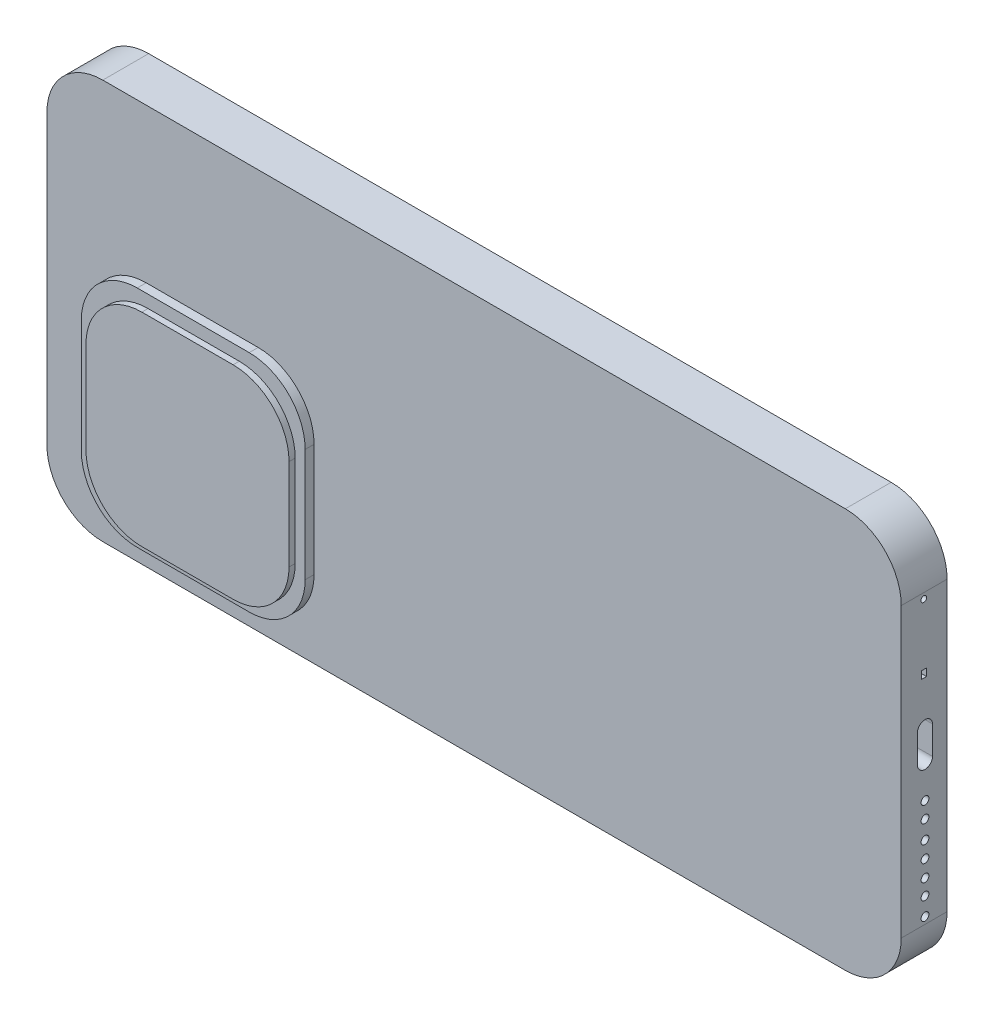
from build123d import *

# Parameters (mm, degrees)
EXTRUDE_1_DEPTH     = 8.2
EXTRUDE_2_DEPTH     = 9.8
EXTRUDE_4_DEPTH     = 10.9
CUT_EXTRUDE_2_DEPTH = 5
SKETCH_10_W         = 0.370057209
SKETCH_10_H         = 5.254812371
EXTRUDE_7_DEPTH     = 3
SKETCH_11_R         = 0.702134187
SKETCH_11_R_2       = 0.7
CUT_EXTRUDE_7_DEPTH = 3
EXTRUDE_9_DEPTH     = 1
EXTRUDE_10_DEPTH    = 1
SKETCH_18_R         = 0.525325968
CUT_EXTRUDE_8_DEPTH = 2
SKETCH_19_W         = 0.887666201
SKETCH_19_H         = 1.337170861
CUT_EXTRUDE_9_DEPTH = 2


with BuildPart() as part:
    # 草图1 → 凸台-拉伸1 (new body)
    with BuildSketch(Plane.XY):
        with BuildLine():
            Line((-10, 0), (-142.8, 0))
            ThreePointArc((-142.8, 0), (-149.871067812, 2.928932188), (-152.8, 10))
            Line((-152.8, 10), (-152.8, 61.5))
            ThreePointArc((-152.8, 61.5), (-149.871067812, 68.571067812), (-142.8, 71.5))
            Line((-142.8, 71.5), (-10, 71.5))
            ThreePointArc((-10, 71.5), (-2.928932188, 68.571067812), (0, 61.5))
            Line((0, 61.5), (0, 10))
            ThreePointArc((0, 10), (-2.928932188, 2.928932188), (-10, 0))
        make_face()
    extrude(amount=EXTRUDE_1_DEPTH)

    # 草图3 → 凸台-拉伸2 (add)
    with BuildSketch(Plane.XY):
        with BuildLine():
            Line((-135.046043945, 43.978629458), (-115.01487361, 43.978629458))
            ThreePointArc((-115.01487361, 43.978629458), (-107.943805798, 41.04969727), (-105.01487361, 33.978629458))
            Line((-105.01487361, 33.978629458), (-105.01487361, 13.799195529))
            ThreePointArc((-105.01487361, 13.799195529), (-107.943805798, 6.728127717), (-115.01487361, 3.799195529))
            Line((-115.01487361, 3.799195529), (-135.046043945, 3.799195529))
            ThreePointArc((-135.046043945, 3.799195529), (-142.117111757, 6.728127717), (-145.046043945, 13.799195529))
            Line((-145.046043945, 13.799195529), (-145.046043945, 33.978629458))
            ThreePointArc((-145.046043945, 33.978629458), (-142.117111757, 41.04969727), (-135.046043945, 43.978629458))
        make_face()
    extrude(amount=EXTRUDE_2_DEPTH)

    # 草图4 → 凸台-拉伸4 (add)
    with BuildSketch(Plane.XY):
        with BuildLine():
            Line((-133.118617225, 41.75467555), (-116.794036736, 41.75467555))
            ThreePointArc((-116.794036736, 41.75467555), (-109.722968924, 38.825743362), (-106.794036736, 31.75467555))
            Line((-106.794036736, 31.75467555), (-106.794036736, 15.430095061))
            ThreePointArc((-106.794036736, 15.430095061), (-109.722968924, 8.359027249), (-116.794036736, 5.430095061))
            Line((-116.794036736, 5.430095061), (-133.118617225, 5.430095061))
            ThreePointArc((-133.118617225, 5.430095061), (-140.189685037, 8.359027249), (-143.118617225, 15.430095061))
            Line((-143.118617225, 15.430095061), (-143.118617225, 31.75467555))
            ThreePointArc((-143.118617225, 31.75467555), (-140.189685037, 38.825743362), (-133.118617225, 41.75467555))
        make_face()
    extrude(amount=EXTRUDE_4_DEPTH)

    # 草图7 → 切除-拉伸2 (cut)
    with BuildSketch(Plane(origin=(0, 0, 0), x_dir=(0, 0, -1), z_dir=(1, 0, 0))):
        with BuildLine():
            Line((-2.606304041, 40.37379104), (-2.606304041, 35.345979424))
            ThreePointArc((-2.606304041, 35.345979424), (-3.953039295, 33.999244169), (-5.299774549, 35.345979424))
            Line((-5.299774549, 35.345979424), (-5.299774549, 40.37379104))
            ThreePointArc((-5.299774549, 40.37379104), (-3.953039295, 41.720526294), (-2.606304041, 40.37379104))
        make_face()
    extrude(amount=-CUT_EXTRUDE_2_DEPTH, mode=Mode.SUBTRACT)

    # 草图10 → 凸台-拉伸7 (add)
    with BuildSketch(Plane(origin=(-5, 0, 0), x_dir=(0, 0, -1), z_dir=(1, 0, 0))):
        with Locations((-3.916033575, 37.74830893)):
            Rectangle(SKETCH_10_W, SKETCH_10_H)
    extrude(amount=EXTRUDE_7_DEPTH)

    # 草图11 → 切除-拉伸7 (cut)
    with BuildSketch(Plane(origin=(0, 0, 0), x_dir=(0, 0, -1), z_dir=(1, 0, 0))):
        with Locations((-3.952008535, 29.199987397)):
            Circle(SKETCH_11_R)
        with Locations((-3.952008535, 26.313541166)):
            Circle(SKETCH_11_R_2)
        with Locations((-3.952008535, 23.057037725)):
            Circle(SKETCH_11_R_2)
        with Locations((-3.952008535, 20.162307769)):
            Circle(SKETCH_11_R_2)
        with Locations((-3.952008535, 17.200540143)):
            Circle(SKETCH_11_R_2)
        with Locations((-3.952008535, 14.38879992)):
            Circle(SKETCH_11_R_2)
        with Locations((-3.952008535, 11.207674531)):
            Circle(SKETCH_11_R_2)
    extrude(amount=-CUT_EXTRUDE_7_DEPTH, mode=Mode.SUBTRACT)

    # 草图16 → 凸台-拉伸9 (add)
    with BuildSketch(Plane(origin=(0, 0, 0), x_dir=(-1, 0, 0), z_dir=(0, -1, 0))):
        with BuildLine():
            Line((122.903060322, -4.499448016), (108.167420624, -4.499448016))
            ThreePointArc((108.167420624, -4.499448016), (107.522736387, -3.854763779), (108.167420624, -3.210079543))
            Line((108.167420624, -3.210079543), (122.903060322, -3.210079543))
            ThreePointArc((122.903060322, -3.210079543), (123.547744559, -3.854763779), (122.903060322, -4.499448016))
        make_face()
    extrude(amount=EXTRUDE_9_DEPTH)

    # 草图17 → 凸台-拉伸10 (add)
    with BuildSketch(Plane(origin=(0, 0, 0), x_dir=(-1, 0, 0), z_dir=(0, -1, 0))):
        with BuildLine():
            Line((98.426104615, -4.674225119), (93.518584009, -4.674225119))
            ThreePointArc((93.518584009, -4.674225119), (92.876478509, -4.03211962), (93.518584009, -3.39001412))
            Line((93.518584009, -3.39001412), (98.426104615, -3.39001412))
            ThreePointArc((98.426104615, -3.39001412), (99.068210115, -4.03211962), (98.426104615, -4.674225119))
        make_face()
    extrude(amount=EXTRUDE_10_DEPTH)

    # 草图18 → 切除-拉伸8 (cut)
    with BuildSketch(Plane(origin=(0, 0, 0), x_dir=(0, 0, -1), z_dir=(1, 0, 0))):
        with Locations((-4.172199498, 60.503169762)):
            Circle(SKETCH_18_R)
    extrude(amount=-CUT_EXTRUDE_8_DEPTH, mode=Mode.SUBTRACT)

    # 草图19 → 切除-拉伸9 (cut)
    with BuildSketch(Plane(origin=(0, 0, 0), x_dir=(0, 0, -1), z_dir=(1, 0, 0))):
        with Locations((-4.129442134, 48.925605997)):
            Rectangle(SKETCH_19_W, SKETCH_19_H)
    extrude(amount=-CUT_EXTRUDE_9_DEPTH, mode=Mode.SUBTRACT)


solid = part.part
